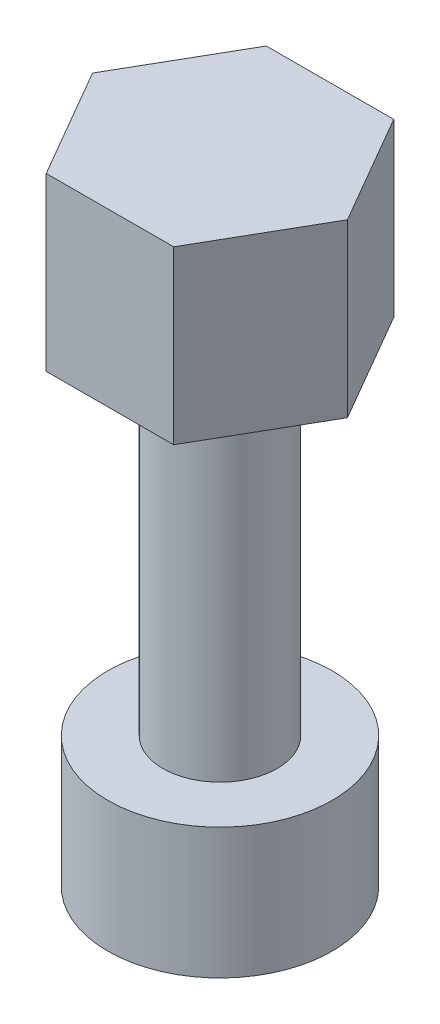
from build123d import *

# Parameters (mm, degrees)
SKETCH1_R           = 2.75
BOSS_EXTRUDE1_DEPTH = 3.2
SKETCH2_R           = 1.4
BOSS_EXTRUDE2_DEPTH = 8.3
BOSS_EXTRUDE3_DEPTH = 4.2


with BuildPart() as part:
    # Sketch1 → Boss-Extrude1 (new body)
    with BuildSketch(Plane(origin=(0, 0, 0), x_dir=(1, 0, 0), z_dir=(0, 1, 0))):
        Circle(SKETCH1_R)
    extrude(amount=BOSS_EXTRUDE1_DEPTH)

    # Sketch2 → Boss-Extrude2 (add)
    with BuildSketch(Plane(origin=(0, 3.2, 0), x_dir=(1, 0, 0), z_dir=(0, 1, 0))):
        Circle(SKETCH2_R)
    extrude(amount=BOSS_EXTRUDE2_DEPTH)

    # Sketch3 → Boss-Extrude3 (add)
    with BuildSketch(Plane(origin=(0, 11.5, 0), x_dir=(1, 0, 0), z_dir=(0, 1, 0))):
        Polygon((1.554649618, 2.702418281), (-1.563038074, 2.697575204), (-3.117687692, -0.004843077), (-1.554649618, -2.702418281), (1.563038074, -2.697575204), (3.117687692, 0.004843077), align=None)
    extrude(amount=BOSS_EXTRUDE3_DEPTH)


solid = part.part
